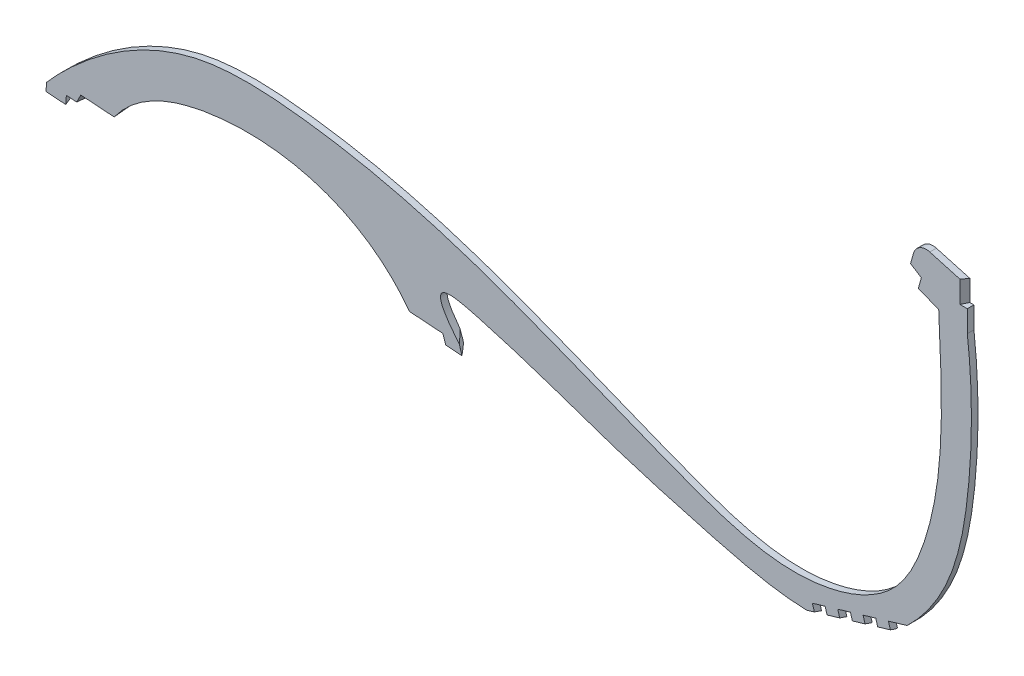
from build123d import *

# Parameters (mm, degrees)
BOSS_EXTRUDE1_DEPTH = 10
SKETCH5_W           = 16.393496479
SKETCH5_H           = 48.543420254
CUT_EXTRUDE4_DEPTH  = 10
FILLET1_R           = 20
CUT_EXTRUDE5_DEPTH  = 20
SKETCH2_W           = 266.878933783
SKETCH2_H           = 117.657326782
CUT_EXTRUDE1_DEPTH  = 20
CUT_EXTRUDE2_START  = -10
CUT_EXTRUDE2_DEPTH  = 10
SKETCH7_W           = 232.341568199
SKETCH7_H           = 131.297347599
CUT_EXTRUDE7_DEPTH  = 10
SKETCH8_W           = 196.09080034
SKETCH8_H           = 207.281719919
CUT_EXTRUDE8_DEPTH  = 10
CUT_EXTRUDE9_DEPTH  = 10
CUT_EXTRUDE10_DEPTH = 20
SKETCH12_R          = 335
CUT_EXTRUDE11_DEPTH = 10


# Read off the part's stored shape, not the designer's step: Cut-Extrude2
with BuildPart() as part:
    # Sketch1 → Boss-Extrude1 (new body)
    with BuildSketch(Plane.XY):
        with BuildLine():
            Line((-224.143138199, -89.008438697), (-225.034899478, -101.687717868))
            Line((-225.034899478, -101.687717868), (-195.108824553, -103.7924838))
            Line((-195.108824553, -103.7924838), (-194.217063275, -91.113204629))
            Line((-194.217063275, -91.113204629), (-129.24985921, -95.682489379))
            Line((-129.24985921, -95.682489379), (-121.88453917, -83.458509674))
            add(Edge.make_bspline(
                [(-121.88453917, -83.458509674), (-86.359944601, -34.056657375), (77.157801675, 25.503787466), (257.585756475, -23.656327645), (325.091213554, -114.895286434)],
                knots=[0, 0, 0, 0, 0.347339048, 1, 1, 1, 1], degree=3))
            Line((325.091213554, -114.895286434), (370.507970324, -118.089545708))
            Line((370.507970324, -118.089545708), (369.616209045, -130.76882488))
            Line((369.616209045, -130.76882488), (404.414099512, -133.216236194))
            Line((404.414099512, -133.216236194), (400.434045248, -120.19431164))
            add(Edge.make_bspline(
                [(1169.249571496, 278.074173603), (1177.314554003, 208.109788394), (1177.643351017, 86.240875214), (1144.683773606, -85.706009433), (1002.169469389, -236.926039486), (806.163413875, -187.659186838), (610.220280141, -132.540392639), (483.008235492, -81.757939333), (341.04601769, -48.952830623), (400.434045248, -120.19431164)],
                knots=[0, 0, 0, 0, 0.170336301, 0.295484966, 0.41847913, 0.623990394, 0.727897997, 0.912540008, 1, 1, 1, 1], degree=3))
            Line((1169.249571496, 278.074173603), (1169.249571496, 340.839179342))
            Line((1169.249571496, 340.839179342), (1093.147160379, 362.129088843))
            Line((1093.147160379, 362.129088843), (1077.73292017, 307.029707356))
            Line((1077.73292017, 307.029707356), (1125.916866635, 288.154341422))
            add(Edge.make_bspline(
                [(1125.916866635, 288.154341422), (1130.51606574, 184.095389065), (1140.005481766, 44.266649713), (1059.05326973, -135.268529583), (901.543613985, -184.044536021), (736.906442656, -125.935459759), (560.129622457, -53.45973878), (369.802059378, 19.388351023), (180.649416995, 60.048114263), (-38.494007152, 70.580532396), (-164.78764586, -21.708555028), (-224.143138199, -89.008438697)],
                knots=[0, 0, 0, 0, 0.176224958, 0.230830699, 0.316251912, 0.420421013, 0.519745579, 0.63903316, 0.761751272, 0.845342445, 1, 1, 1, 1], degree=3))
        make_face()
    extrude(amount=-BOSS_EXTRUDE1_DEPTH)

    # Sketch5 → Cut-Extrude4 (cut)
    with BuildSketch(Plane(origin=(952.830924964, 0, 454.103929904), x_dir=(0.430223103306106, 0, -0.9027225938136608), z_dir=(0.9027225938136609, 0, 0.4302231033061061))):
        with Locations((503.868656887, 335.110889469)):
            Rectangle(SKETCH5_W, SKETCH5_H)
    extrude(amount=-CUT_EXTRUDE4_DEPTH, mode=Mode.SUBTRACT)

    # Fillet1
    fillet1_edges = [part.edges().sort_by_distance(p)[0] for p in [
        (1093.147160379, 362.129088843, -5),
    ]]
    fillet(fillet1_edges, radius=FILLET1_R)

    # Sketch6 → Cut-Extrude5 (cut, symmetric)
    with BuildSketch(Plane(origin=(861.370527332, -240.829766539, 229.166537517), x_dir=(-0.2390378258647879, 0.06683235839911318, 0.968707568710314), z_dir=(-0.9329300110533632, 0.26083701453708547, -0.24820484750172023))):
        Polygon((-212.600047382, 620.5483145), (-202.249343658, 611.990118655), (-238.697004273, 572.740479268), (-242.550537151, 563.247869573), (-260.608073846, 578.178249153), (-257.070909049, 582.456270537), (-220.306880353, 626.920498235), align=None)
    extrude(amount=CUT_EXTRUDE5_DEPTH, both=True, mode=Mode.SUBTRACT)

    # Sketch2 → Cut-Extrude1 (cut)
    with BuildSketch(Plane(origin=(119.646297479, -404.119948081, 127.905432905), x_dir=(0.9623957318183638, 0.25898885075059447, -0.0819709129184389), z_dir=(0.2716513489342469, -0.9175355304833995, 0.2904033314594559))):
        with Locations((946.617271348, -76.418259459)):
            Rectangle(SKETCH2_W, SKETCH2_H)
    extrude(amount=CUT_EXTRUDE1_DEPTH, mode=Mode.SUBTRACT)

    # Cut-Extrude2 outline → Cut-Extrude2 (cut)
    with BuildSketch(Plane(origin=(119.646297479, -404.119948081, 127.905432905), x_dir=(0.9623957318183638, 0.25898885075059447, -0.081970912918439), z_dir=(0.271651348934247, -0.9175355304833995, 0.29040333145945596)).offset(CUT_EXTRUDE2_START)):
        Polygon((969.365697313, -47.768231438), (970.499709168, -60.957691752), (971.535090449, -73), (1000, -73), (1000, -44), (969.0417099, -44), align=None)
        Polygon((931.387516146, -73), (951.461303299, -73), (950.594389362, -62.917101033), (949.439213238, -49.481483431), (948.967922749, -44), (928.894135599, -44), (929.512729163, -51.194735425), (930.667905286, -64.630353027), align=None)
        Polygon((891.239941845, -73), (911.313728996, -73), (910.741421211, -66.34360502), (909.586245088, -52.907987418), (908.820348449, -44), (888.746561296, -44), (889.659761012, -54.621239412), (890.814937136, -68.056857014), align=None)
        Polygon((851.092367517, -73), (871.166154665, -73), (870.888453038, -69.770109009), (869.733276943, -56.334491405), (868.672774178, -44), (848.59898703, -44), (849.806792867, -58.047743398), (850.961968962, -71.483361002), align=None)
    extrude(amount=CUT_EXTRUDE2_DEPTH, mode=Mode.SUBTRACT)

    # Sketch7 → Cut-Extrude7 (cut)
    with BuildSketch(Plane(origin=(-4.538663176, -64.531819058, -50.756591038), x_dir=(0.9984754763769406, -0.04338519286414303, -0.03412401081325018), z_dir=(0.055197129217394114, 0.7848062340727613, 0.6172782613106417))):
        with Locations((349.280076578, -73.679474055)):
            Rectangle(SKETCH7_W, SKETCH7_H)
    extrude(amount=-CUT_EXTRUDE7_DEPTH, mode=Mode.SUBTRACT)

    # Sketch8 → Cut-Extrude8 (cut)
    with BuildSketch(Plane(origin=(-5.090634469, -72.379881399, -56.929373652), x_dir=(0.9984754763769406, -0.04338519286414303, -0.03412401081325018), z_dir=(-0.055197129217394114, -0.7848062340727613, -0.6172782613106417))):
        with Locations((-187.128612195, 67.601673863)):
            Rectangle(SKETCH8_W, SKETCH8_H)
    extrude(amount=CUT_EXTRUDE8_DEPTH, mode=Mode.SUBTRACT)

    # Sketch10 → Cut-Extrude9 (cut)
    with BuildSketch(Plane(origin=(-4.538663176, -64.531819058, -50.756591038), x_dir=(0.9984754763769406, -0.04338519286414303, -0.03412401081325018), z_dir=(0.05519712921739411, 0.7848062340727607, 0.6172782613106421))):
        Polygon((-189.968010818, -56.328074015), (-189.62677071, -48.46802885), (-189.103712664, -36.420031646), (-100.603902196, -39.334428319), (-109.894798702, -74.854958825), align=None)
    extrude(amount=-CUT_EXTRUDE9_DEPTH, mode=Mode.SUBTRACT)

    # Sketch11 → Cut-Extrude10 (cut)
    with BuildSketch(Plane(origin=(-4.538663176, -64.531819058, -50.756591038), x_dir=(0.9984754763769406, -0.04338519286414303, -0.03412401081325018), z_dir=(0.055197129217394114, 0.7848062340727613, 0.6172782613106417))):
        with BuildLine():
            Line((426.347562196, -117.459177681), (481.346422669, -98.568263703))
            ThreePointArc((481.346422669, -98.568263703), (445.714891194, -29.544553711), (397.812223022, 31.604550603))
            Line((397.812223022, 31.604550603), (352.497196956, -5.030923523))
            ThreePointArc((352.497196956, -5.030923523), (394.784246693, -57.72301917), (426.347562196, -117.459177681))
        make_face()
    extrude(amount=CUT_EXTRUDE10_DEPTH, mode=Mode.SUBTRACT)

    # Sketch12 → Cut-Extrude11 (cut)
    with BuildSketch(Plane(origin=(-3.986691884, -56.683756717, -44.583808425), x_dir=(0.9984754763769406, -0.04338519286414303, -0.03412401081325018), z_dir=(0.055197129217394114, 0.7848062340727613, 0.6172782613106417))):
        with Locations((97.427222283, -253.046917275)):
            Circle(SKETCH12_R)
    extrude(amount=-CUT_EXTRUDE11_DEPTH, mode=Mode.SUBTRACT)


solid = part.part
